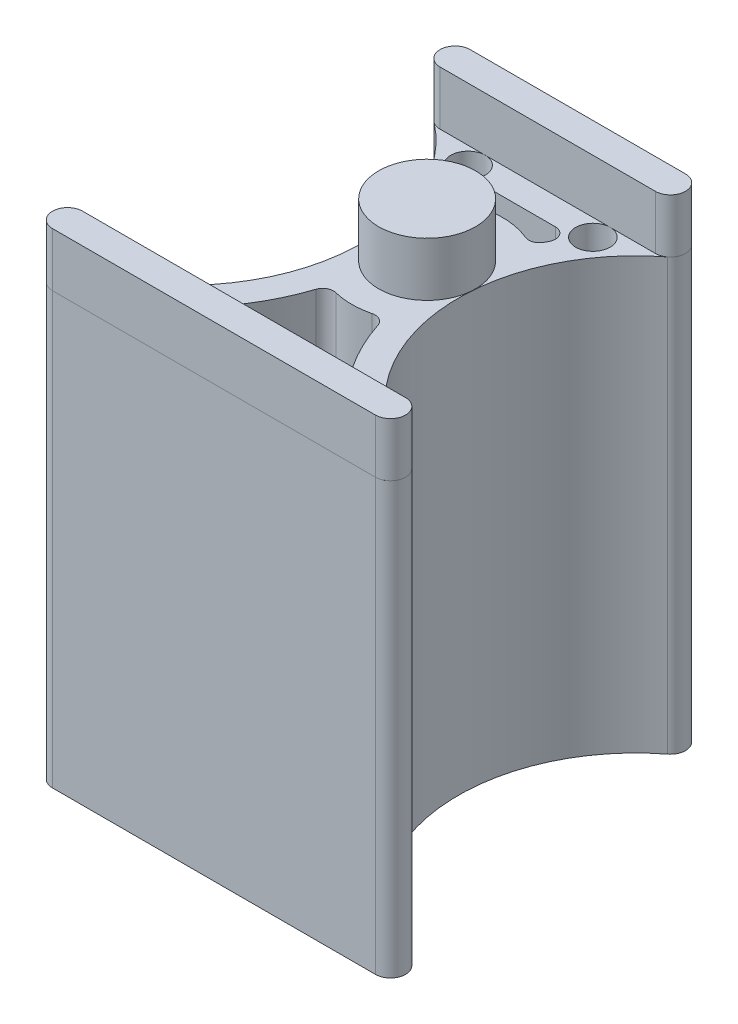
from build123d import *

# Parameters (mm, degrees)
SKETCH1_R             = 4.5
BOSS_EXTRUDE1_DEPTH   = 5
BOSS_EXTRUDE1_2_DEPTH = 5
BOSS_EXTRUDE1_3_DEPTH = 5
BOSS_EXTRUDE2_DEPTH   = 40
CUT_EXTRUDE1_DEPTH    = 48.549973712
FILLET1_R             = 1
CUT_EXTRUDE2_DEPTH    = 48.549973872
FILLET2_R             = 1
SKETCH5_R             = 1.6
CUT_EXTRUDE3_DEPTH    = 48.549973872


with BuildPart() as part:
    # Sketch1 → Boss-Extrude1 (new body)
    with BuildSketch(Plane(origin=(0, 0, 0), x_dir=(1, 0, 0), z_dir=(0, 1, 0))):
        Circle(SKETCH1_R)
    extrude(amount=BOSS_EXTRUDE1_DEPTH)


with BuildPart() as body_2:
    # Sketch1 → Boss-Extrude1 2 (new body)
    with BuildSketch(Plane(origin=(0, 0, 0), x_dir=(1, 0, 0), z_dir=(0, 1, 0))):
        with BuildLine():
            Line((-10, 14), (10, 14))
            ThreePointArc((10, 14), (11.4, 12.6), (10, 11.2))
            Line((10, 11.2), (-10, 11.2))
            ThreePointArc((-10, 11.2), (-11.4, 12.6), (-10, 14))
        make_face()
    extrude(amount=BOSS_EXTRUDE1_2_DEPTH)


with BuildPart() as body_3:
    # Sketch1 → Boss-Extrude1 3 (new body)
    with BuildSketch(Plane(origin=(0, 0, 0), x_dir=(1, 0, 0), z_dir=(0, 1, 0))):
        with BuildLine():
            Line((-15, -17), (15, -17))
            ThreePointArc((15, -17), (16.4, -18.4), (15, -19.8))
            Line((15, -19.8), (-15, -19.8))
            ThreePointArc((-15, -19.8), (-16.4, -18.4), (-15, -17))
        make_face()
    extrude(amount=BOSS_EXTRUDE1_3_DEPTH)


with BuildPart() as body_4:
    # Sketch2 → Boss-Extrude2 (new body)
    with BuildSketch(Plane.XZ):
        with BuildLine():
            Line((15, 19.8), (-15, 19.8))
            ThreePointArc((-15, 19.8), (-16.380197786, 18.634636041), (-15.462634492, 17.078648674))
            ThreePointArc((-15.462634492, 17.078648674), (-4.654417231, 4.174499379), (-10.840274527, -11.480205948))
            ThreePointArc((-10.840274527, -11.480205948), (-11.328102344, -13.042881658), (-10, -14))
            Line((-10, -14), (10, -14))
            ThreePointArc((10, -14), (11.328102344, -13.042881658), (10.840274527, -11.480205948))
            ThreePointArc((10.840274527, -11.480205948), (4.654417231, 4.174499379), (15.462634492, 17.078648674))
            ThreePointArc((15.462634492, 17.078648674), (16.380197786, 18.634636041), (15, 19.8))
        make_face()
    extrude(amount=BOSS_EXTRUDE2_DEPTH)

    # Sketch3 → Cut-Extrude1 (cut, through all)
    with BuildSketch(Plane(origin=(0, 0, 0), x_dir=(1, 0, 0), z_dir=(0, 1, 0))):
        with BuildLine():
            Line((-7.059953154, -14.5), (7.059953154, -14.5))
            ThreePointArc((7.059953154, -14.5), (4.34028867, -10.772593144), (2.60161457, -6.498584587))
            ThreePointArc((2.60161457, -6.498584587), (0, -7), (-2.60161457, -6.498584587))
            ThreePointArc((-2.60161457, -6.498584587), (-4.34028867, -10.772593144), (-7.059953154, -14.5))
        make_face()
    extrude(amount=-CUT_EXTRUDE1_DEPTH, mode=Mode.SUBTRACT)

    # Fillet1
    fillet1_edges = [body_4.edges().sort_by_distance(p)[0] for p in [
        (2.60161457, -20, 6.498584587),
        (-2.60161457, -20, 6.498584587),
        (7.059953154, -20, 14.5),
        (-7.059953154, -20, 14.5),
    ]]
    fillet(fillet1_edges, radius=FILLET1_R)

    # Sketch4 → Cut-Extrude2 (cut, through all)
    with BuildSketch(Plane(origin=(0, 0, 0), x_dir=(1, 0, 0), z_dir=(0, 1, 0))):
        with BuildLine():
            Line((4.949476545, 8.7), (-4.949476545, 8.7))
            ThreePointArc((-4.949476545, 8.7), (-4.186347115, 7.400983677), (-3.528776397, 6.04547245))
            ThreePointArc((-3.528776397, 6.04547245), (0, 7), (3.528776397, 6.04547245))
            ThreePointArc((3.528776397, 6.04547245), (4.186347115, 7.400983677), (4.949476545, 8.7))
        make_face()
    extrude(amount=-CUT_EXTRUDE2_DEPTH, mode=Mode.SUBTRACT)

    # Fillet2
    fillet2_edges = [body_4.edges().sort_by_distance(p)[0] for p in [
        (3.528776397, -20, -6.04547245),
        (-3.528776397, -20, -6.04547245),
        (4.949476545, -20, -8.7),
        (-4.949476545, -20, -8.7),
    ]]
    fillet(fillet2_edges, radius=FILLET2_R)

    # Sketch5 → Cut-Extrude3 (cut, through all)
    with BuildSketch(Plane(origin=(0, 0, 0), x_dir=(1, 0, 0), z_dir=(0, 1, 0))):
        with Locations((-7.7, -15.4)):
            Circle(SKETCH5_R)
        with Locations((7.7, -15.4)):
            Circle(SKETCH5_R)
        with Locations((-5.8, 9.6)):
            Circle(SKETCH5_R)
        with Locations((5.8, 9.6)):
            Circle(SKETCH5_R)
    extrude(amount=-CUT_EXTRUDE3_DEPTH, mode=Mode.SUBTRACT)


solid = Compound([part.part, body_2.part, body_3.part, body_4.part])
